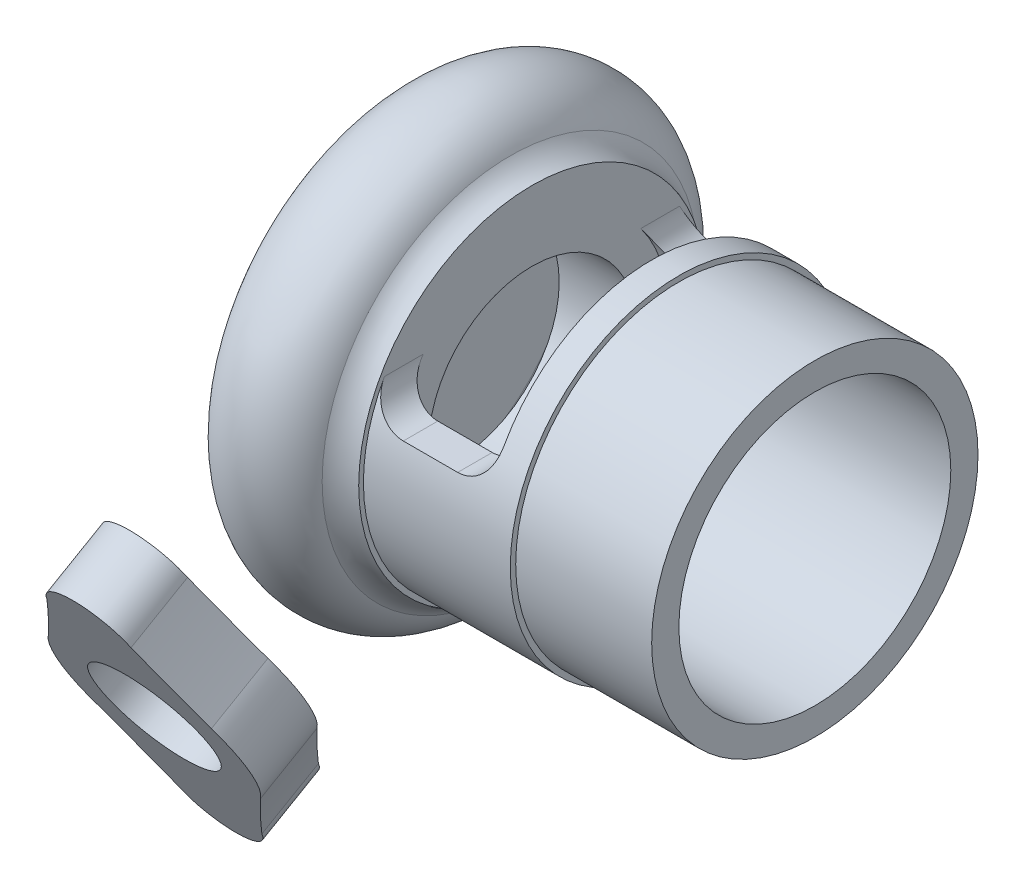
from build123d import *

# Parameters (mm, degrees)
SKETCH3_R               = 31
SKETCH3_R_2             = 25
BOSS_EXTRUDE1_DEPTH     = 22
CUT_EXTRUDE1_DEPTH      = 66.749524713
CUT_EXTRUDE1_DEPTH_BACK = 66.749524713
SKETCH12_R              = 11
BOSS_EXTRUDE2_DEPTH     = 12


with BuildPart() as part:
    # Sketch1 → Revolve1 (revolve)
    with BuildSketch(Plane.XY):
        Polygon((49, 25), (19, 25), (19, 31), (24, 31), (24, 30), (49, 30), align=None)
    revolve(axis=Axis((-49, 0, 0), (1, 0, 0)))

    # Sketch3 → Boss-Extrude1 (add)
    with BuildSketch(Plane.ZY.offset(-19)):
        Circle(SKETCH3_R)
        Circle(SKETCH3_R_2, mode=Mode.SUBTRACT)
    extrude(amount=BOSS_EXTRUDE1_DEPTH)

    # Sketch4 → Cut-Extrude1 (cut, two sides: drawn at the far end of the back side and taken through both)
    with BuildSketch(Plane.XY.offset(-CUT_EXTRUDE1_DEPTH_BACK)):
        with BuildLine():
            Line((-3, 31), (19, 31))
            Line((19, 31), (19, 15))
            ThreePointArc((19, 15), (17.242640687, 10.757359313), (13, 9))
            Line((13, 9), (3, 9))
            ThreePointArc((3, 9), (-1.242640687, 10.757359313), (-3, 15))
            Line((-3, 15), (-3, 31))
        make_face()
    extrude(amount=CUT_EXTRUDE1_DEPTH + CUT_EXTRUDE1_DEPTH_BACK, mode=Mode.SUBTRACT)

    # Sketch10 → Revolve2 (revolve)
    with BuildSketch(Plane.XY):
        with BuildLine():
            Line((-3, 19), (-3, 31.867711866))
            ThreePointArc((-3, 31.867711866), (-5.24492632, 32.866535949), (-7.001114883, 34.585007788))
            ThreePointArc((-7.001114883, 34.585007788), (-19.346514832, 40.746807346), (-28, 30))
            Line((-28, 30), (-28, 0))
            Line((-28, 0), (-25, 0))
            Line((-25, 0), (-25, 30))
            ThreePointArc((-25, 30), (-11.343145751, 35.656854249), (-17, 22))
            Line((-17, 22), (-17, 19))
            Line((-17, 19), (-3, 19))
        make_face()
    revolve(axis=Axis((49, 0, 0), (-1, 0, 0)))


with BuildPart() as body_2:
    # Sketch12 → Boss-Extrude2 (new body)
    with BuildSketch(Plane(origin=(0, -32, 55.425625842), x_dir=(1, 0, 0), z_dir=(0, -0.5000000000000013, 0.8660254037844379))):
        with BuildLine():
            ThreePointArc((-9.270893516, 24.064197899), (-17, 30), (-24.729106484, 24.064197899))
            ThreePointArc((-24.729106484, 24.064197899), (-28.24985512, 16.494307295), (-31.990055384, 9.030406391))
            ThreePointArc((-31.990055384, 9.030406391), (-34.5, 0), (-31.990055384, -9.030406391))
            ThreePointArc((-31.990055384, -9.030406391), (-28.24985512, -16.494307295), (-24.729106484, -24.064197899))
            ThreePointArc((-24.729106484, -24.064197899), (-17, -30), (-9.270893516, -24.064197899))
            ThreePointArc((-9.270893516, -24.064197899), (-5.75014488, -16.494307295), (-2.009944616, -9.030406391))
            ThreePointArc((-2.009944616, -9.030406391), (0.5, 0), (-2.009944616, 9.030406391))
            ThreePointArc((-2.009944616, 9.030406391), (-5.75014488, 16.494307295), (-9.270893516, 24.064197899))
        make_face()
        with Locations((-17, 0)):
            Circle(SKETCH12_R, mode=Mode.SUBTRACT)
    extrude(amount=-BOSS_EXTRUDE2_DEPTH)


solid = Compound([part.part, body_2.part])
